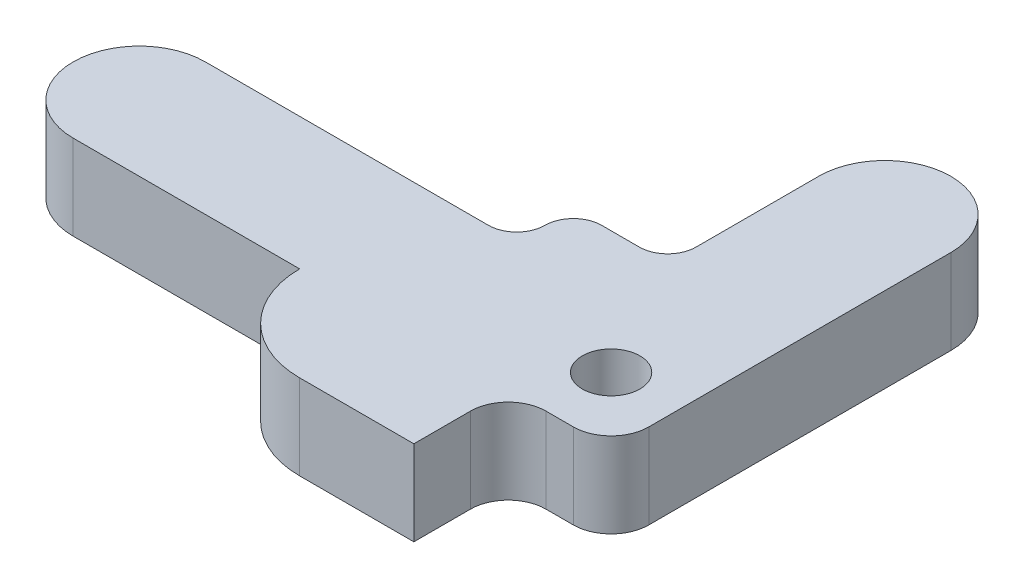
from build123d import *

# Parameters (mm, degrees)
SKETCH_1_R      = 1.525
EXTRUDE_1_DEPTH = 4.5
SKETCH_2_W      = 5
SKETCH_2_H      = 3
EXTRUDE_2_DEPTH = 4
FILLET_1_R      = 3.5
FILLET_3_R      = 1.5
FILLET_4_R      = 5
FILLET_5_R      = 2


with BuildPart() as part:
    # 草图1 → 凸台-拉伸1 (new body)
    with BuildSketch(Plane(origin=(0, 0, 0), x_dir=(1, 0, 0), z_dir=(0, 1, 0))):
        Polygon((3.5, -3.5), (3.5, 18), (-3.5, 18), (-3.5, 6.5), (-8.5, 6.5), (-8.5, 3.5), (-28.5, 3.5), (-28.5, -3.5), (-13, -3.5), (-13, -8.5), (-7.55, -8.5), (-1.95, -8.5), (-1.95, -3.5), align=None)
        with Locations(Location((0, 0, 0), (0, 0, 270))):
            Circle(SKETCH_1_R, mode=Mode.SUBTRACT)
    extrude(amount=EXTRUDE_1_DEPTH)

    # 草图2 → 凸台-拉伸2 (add)
    with BuildSketch(Plane(origin=(0, 0, 0), x_dir=(1, 0, 0), z_dir=(0, 1, 0))):
        with Locations((-6, 5)):
            Rectangle(SKETCH_2_W, SKETCH_2_H)
    extrude(amount=-EXTRUDE_2_DEPTH)

    # 圆角1
    fillet_1_edges = [part.edges().sort_by_distance(p)[0] for p in [
        (3.5, 2.25, -18),
        (-3.5, 2.25, -18),
        (-28.5, 2.25, 3.5),
        (-28.5, 2.25, -3.5),
    ]]
    fillet(fillet_1_edges, radius=FILLET_1_R - 0.0001)  # a hair under: the kernel refuses the full size

    # 圆角3
    fillet_3_edges = [part.edges().sort_by_distance(p)[0] for p in [
        (-8.5, 2.25, -3.5),
        (-8.5, 0.25, -6.5),
        (-3.5, 2.25, -6.5),
    ]]
    fillet(fillet_3_edges, radius=FILLET_3_R - 0.0001)  # a hair under: the kernel refuses the full size

    # 圆角4
    fillet_4_edges = [part.edges().sort_by_distance(p)[0] for p in [
        (-13, 2.25, 8.5),
    ]]
    fillet(fillet_4_edges, radius=FILLET_4_R - 0.0001)  # a hair under: the kernel refuses the full size

    # 圆角5
    fillet_5_edges = [part.edges().sort_by_distance(p)[0] for p in [
        (3.5, 2.25, 3.5),
        (-1.95, 2.25, 3.5),
    ]]
    fillet(fillet_5_edges, radius=FILLET_5_R)


solid = part.part
